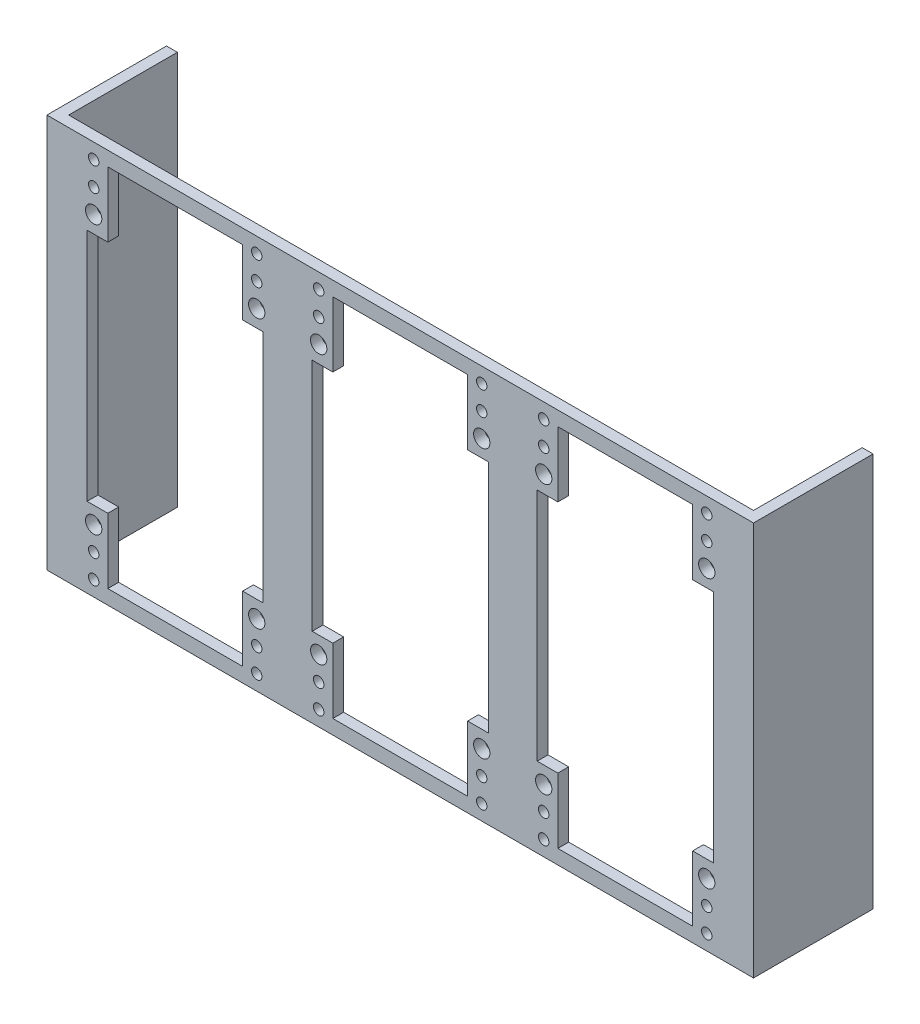
from build123d import *

# Parameters (mm, degrees)
SKETCH1_W           = 165.1
SKETCH1_H           = 92.075
BOSS_EXTRUDE1_DEPTH = 2.54
SKETCH2_R           = 1.905
SKETCH2_R_2         = 1.2192
CUT_EXTRUDE1_DEPTH  = 2.54
SKETCH4_W           = 2.54
SKETCH4_H           = 92.075
BOSS_EXTRUDE3_DEPTH = 25.4


with BuildPart() as part:
    # Sketch1 → Boss-Extrude1 (new body)
    with BuildSketch(Plane.XY):
        with Locations((259.660273445, 73.209654415)):
            Rectangle(SKETCH1_W, SKETCH1_H)
    extrude(amount=-BOSS_EXTRUDE1_DEPTH)

    # Sketch2 → Cut-Extrude1 (cut)
    with BuildSketch(Plane.XY):
        with Locations((188.032273445, 41.815254415)):
            Circle(SKETCH2_R)
        with Locations((226.132273445, 104.604054415)):
            Circle(SKETCH2_R)
        with Locations((188.032273445, 104.604054415)):
            Circle(SKETCH2_R)
        with Locations((188.032273445, 36.278054415)):
            Circle(SKETCH2_R_2)
        with Locations((188.032273445, 30.715454415)):
            Circle(SKETCH2_R_2)
        with Locations((226.132273445, 41.815254415)):
            Circle(SKETCH2_R)
        with Locations((226.132273445, 36.278054415)):
            Circle(SKETCH2_R_2)
        with Locations((226.132273445, 30.715454415)):
            Circle(SKETCH2_R_2)
        with Locations((226.132273445, 110.141254415)):
            Circle(SKETCH2_R_2)
        with Locations((226.132273445, 115.703854415)):
            Circle(SKETCH2_R_2)
        with Locations((188.032273445, 110.141254415)):
            Circle(SKETCH2_R_2)
        with Locations((188.032273445, 115.703854415)):
            Circle(SKETCH2_R_2)
        with Locations((240.610273445, 41.815254415)):
            Circle(SKETCH2_R)
        with Locations((278.710273445, 104.604054415)):
            Circle(SKETCH2_R)
        with Locations((240.610273445, 104.604054415)):
            Circle(SKETCH2_R)
        with Locations((240.610273445, 36.278054415)):
            Circle(SKETCH2_R_2)
        with Locations((240.610273445, 30.715454415)):
            Circle(SKETCH2_R_2)
        with Locations((278.710273445, 41.815254415)):
            Circle(SKETCH2_R)
        with Locations((278.710273445, 36.278054415)):
            Circle(SKETCH2_R_2)
        with Locations((278.710273445, 30.715454415)):
            Circle(SKETCH2_R_2)
        with Locations((278.710273445, 110.141254415)):
            Circle(SKETCH2_R_2)
        with Locations((278.710273445, 115.703854415)):
            Circle(SKETCH2_R_2)
        with Locations((240.610273445, 110.141254415)):
            Circle(SKETCH2_R_2)
        with Locations((240.610273445, 115.703854415)):
            Circle(SKETCH2_R_2)
        with Locations((293.188273445, 41.815254415)):
            Circle(SKETCH2_R)
        with Locations((331.288273445, 104.604054415)):
            Circle(SKETCH2_R)
        with Locations((293.188273445, 104.604054415)):
            Circle(SKETCH2_R)
        with Locations((293.188273445, 36.278054415)):
            Circle(SKETCH2_R_2)
        with Locations((293.188273445, 30.715454415)):
            Circle(SKETCH2_R_2)
        with Locations((331.288273445, 41.815254415)):
            Circle(SKETCH2_R)
        with Locations((331.288273445, 36.278054415)):
            Circle(SKETCH2_R_2)
        with Locations((331.288273445, 30.715454415)):
            Circle(SKETCH2_R_2)
        with Locations((331.288273445, 110.141254415)):
            Circle(SKETCH2_R_2)
        with Locations((331.288273445, 115.703854415)):
            Circle(SKETCH2_R_2)
        with Locations((293.188273445, 110.141254415)):
            Circle(SKETCH2_R_2)
        with Locations((293.188273445, 115.703854415)):
            Circle(SKETCH2_R_2)
        Polygon((191.334273445, 115.881654415), (222.830273445, 115.881654415), (222.830273445, 100.641654415), (227.656273445, 100.641654415), (227.656273445, 45.777654415), (222.830273445, 45.777654415), (222.830273445, 30.537654415), (191.334273445, 30.537654415), (191.334273445, 45.777654415), (186.508273445, 45.777654415), (186.508273445, 100.641654415), (191.334273445, 100.641654415), align=None)
        Polygon((243.912273445, 115.881654415), (275.408273445, 115.881654415), (275.408273445, 100.641654415), (280.234273445, 100.641654415), (280.234273445, 45.777654415), (275.408273445, 45.777654415), (275.408273445, 30.537654415), (243.912273445, 30.537654415), (243.912273445, 45.777654415), (239.086273445, 45.777654415), (239.086273445, 100.641654415), (243.912273445, 100.641654415), align=None)
        Polygon((296.490273445, 115.881654415), (327.986273445, 115.881654415), (327.986273445, 100.641654415), (332.812273445, 100.641654415), (332.812273445, 45.777654415), (327.986273445, 45.777654415), (327.986273445, 30.537654415), (296.490273445, 30.537654415), (296.490273445, 45.777654415), (291.664273445, 45.777654415), (291.664273445, 100.641654415), (296.490273445, 100.641654415), align=None)
    extrude(amount=-CUT_EXTRUDE1_DEPTH, mode=Mode.SUBTRACT)

    # Sketch4 → Boss-Extrude3 (add)
    with BuildSketch(Plane(origin=(0, 0, -2.54), x_dir=(-1, 0, 0), z_dir=(0, 0, -1))):
        with Locations((-340.940273445, 73.209654415)):
            Rectangle(SKETCH4_W, SKETCH4_H)
        with Locations((-178.380273445, 73.209654415)):
            Rectangle(SKETCH4_W, SKETCH4_H)
    extrude(amount=BOSS_EXTRUDE3_DEPTH)


solid = part.part
